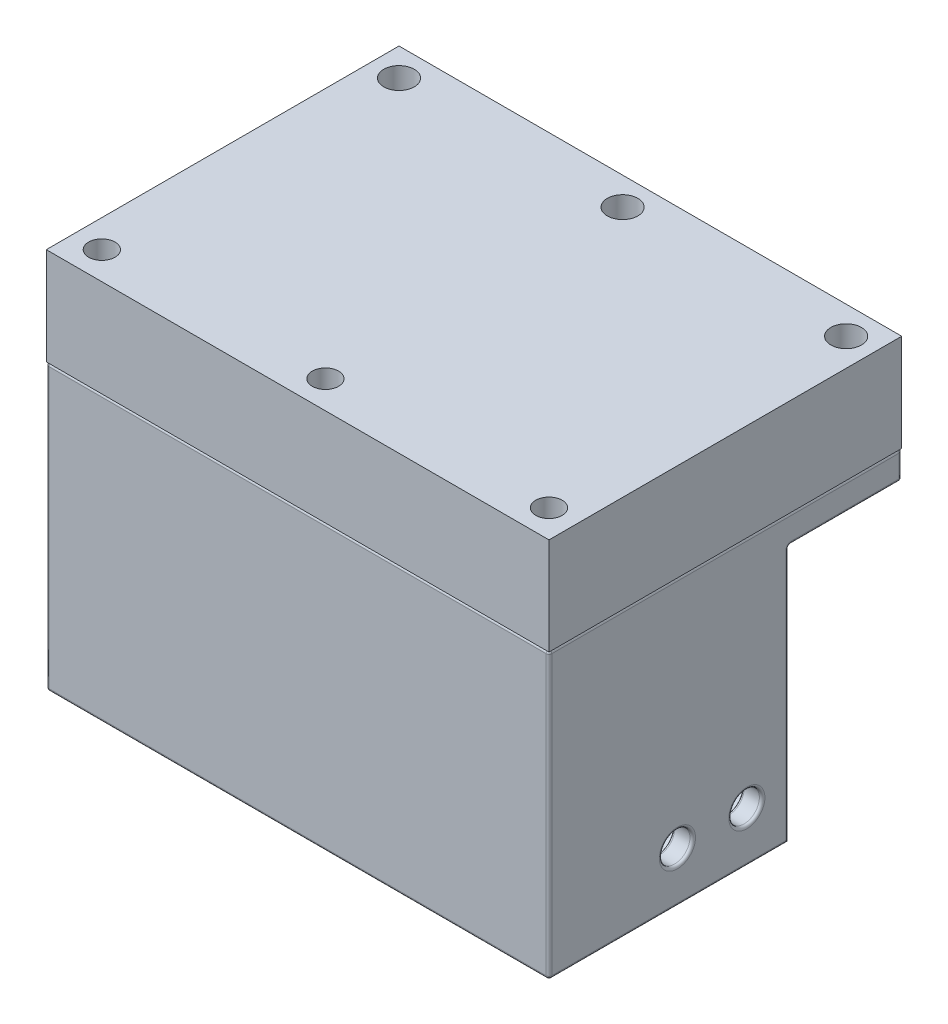
from build123d import *

# Parameters (mm, degrees)
SKETCH_1_W                = 26.2
SKETCH_1_H                = 15.4
SKETCH_1_R                = 1.5
SKETCH_1_W_2              = 25
SKETCH_1_H_2              = 2.55
EXTRUDE_1_DEPTH           = 1.6
SKETCH_1_3_W              = 25
SKETCH_1_3_H              = 2.55
EXTRUDE_2_DEPTH           = 2.65
SKETCH_2_W                = 0.628205128
SKETCH_2_H                = 3.5
EXTRUDE_3_DEPTH           = 1.7
SKETCH_3_W                = 36.2
SKETCH_3_H                = 25.4
SKETCH_3_W_2              = 26.2
SKETCH_3_H_2              = 15.4
SKETCH_3_R                = 1.5
SKETCH_3_W_3              = 25.4
SKETCH_3_H_3              = 2.95
SKETCH_3_R_2              = 1.45
EXTRUDE_4_DEPTH           = 2
SKETCH_4_W                = 36.2
SKETCH_4_H                = 25.4
SKETCH_4_R                = 1.1
SKETCH_4_R_2              = 0.95
SKETCH_4_W_2              = 28.2
SKETCH_4_H_2              = 17.4
EXTRUDE_5_DEPTH           = 5
SKETCH_5_W                = 36.2
SKETCH_5_H                = 25.4
SKETCH_5_R                = 0.95
SKETCH_5_R_2              = 1.1
EXTRUDE_6_DEPTH           = 2
SKETCH_6_W                = 36.2
SKETCH_6_H                = 17.25
SKETCH_6_R                = 1.45
EXTRUDE_8_DEPTH           = 18.68
CUT_EXTRUDE_START         = -25.68
CUT_EXTRUDE_1_OUTLINE_R   = 0.95
CUT_EXTRUDE_1_OUTLINE_R_2 = 1.1
CUT_EXTRUDE_1_DEPTH       = 20.68
SKETCH_11_R               = 1.1
CUT_EXTRUDE_3_DEPTH       = 44.582019228
SKETCH_12_W               = 30.2
SKETCH_12_H               = 7.68
CUT_EXTRUDE_4_DEPTH       = 13.25
CUT_EXTRUDE_START_2       = -3
CUT_EXTRUDE_5_DEPTH       = 1.5
CUT_EXTRUDE_START_3       = -33.2
CUT_EXTRUDE_6_DEPTH       = 1.5
CUT_EXTRUDE_7_DEPTH       = 0.2
FILLET_1_R                = 0.2


# Read off the part's stored shape, not the designer's step: 컷-돌출1
with BuildPart() as part:
    # 스케치1 → 보스-돌출1 (new body)
    # profile 1 of 2: a face of its own
    with BuildSketch(Plane(origin=(0, 0, 0), x_dir=(1, 0, 0), z_dir=(0, 1, 0))):
        Rectangle(SKETCH_1_W, SKETCH_1_H)
        with Locations(Location((-10.15, -5.1, 0), (0, 0, 270))):
            Circle(SKETCH_1_R, mode=Mode.SUBTRACT)
        with Locations(Location((10.15, -5.1, 0), (0, 0, 270))):
            Circle(SKETCH_1_R, mode=Mode.SUBTRACT)
        with Locations((0, 6.025)):
            Rectangle(SKETCH_1_W_2, SKETCH_1_H_2, mode=Mode.SUBTRACT)
    # profile 2 of 2: a face of its own
    with BuildSketch(Plane(origin=(0, 0, 0), x_dir=(1, 0, 0), z_dir=(0, 1, 0))):
        with Locations((0, 6.025)):
            Rectangle(SKETCH_1_W_2, SKETCH_1_H_2)
    extrude(amount=EXTRUDE_1_DEPTH)

    # 스케치1<3> → 보스-돌출2 (add)
    with BuildSketch(Plane(origin=(0, 0, 0), x_dir=(1, 0, 0), z_dir=(0, 1, 0))):
        with Locations((0, 6.025)):
            Rectangle(SKETCH_1_3_W, SKETCH_1_3_H)
    extrude(amount=-EXTRUDE_2_DEPTH)

    # 스케치2 → 보스-돌출3 (add)
    with BuildSketch(Plane(origin=(0, 1.6, 0), x_dir=(1, 0, 0), z_dir=(0, 1, 0))):
        Polygon((0.5, -1.5), (-0.5, -1.5), (-0.5, -5.5), (-1.2, -5.5), (0, -6.930104311), (1.2, -5.5), (0.5, -5.5), align=None)
        Polygon((5.5, -1.2), (6.930104311, 0), (5.5, 1.2), (5.5, 0.5), (1.5, 0.5), (1.5, -0.5), (5.5, -0.5), align=None)
        with Locations((-3.28532471, 3.544331345)):
            Rectangle(SKETCH_2_W, SKETCH_2_H)
        Polygon((-1.886586729, 5.294331345), (-1.23454346, 5.294331345), (-0.435965736, 2.853025255), (0.368220963, 5.294331345), (1.013954136, 5.294331345), (1.605700931, 1.794331345), (0.969783463, 1.794331345), (0.596085547, 4.004968364), (-0.131678877, 1.794331345), (-0.744459325, 1.794331345), (-1.468017018, 4.004968364), (-1.841013812, 1.794331345), (-2.477632402, 1.794331345), align=None)
        with BuildLine():
            Line((2.189034264, 5.294331345), (2.817239393, 5.294331345))
            Line((2.817239393, 5.294331345), (2.817239393, 3.017087755))
            add(Edge.make_bspline(
                [(2.817239393, 3.017087755), (2.817273551, 2.993478281), (2.817339529, 2.947876826), (2.82064238, 2.882453669), (2.823664717, 2.822316089), (2.82911787, 2.767529925), (2.837174047, 2.71807174), (2.844975055, 2.673623833), (2.855532948, 2.634981994), (2.871399773, 2.590997464), (2.895845342, 2.541578443), (2.935788046, 2.490072805), (2.981878508, 2.443066435), (3.037120582, 2.403940113), (3.099207788, 2.372290446), (3.167798984, 2.348841544), (3.242797481, 2.335807069), (3.294654828, 2.333817117), (3.321345963, 2.332792883)],
                knots=[0, 0, 0, 0, 1.155499968, 2.231836252, 3.205919964, 4.102923608, 4.924856345, 5.658536265, 6.31071849, 6.882491295, 7.94666036, 8.992281882, 10.060072772, 11.158554251, 12.289267114, 13.461410017, 14.693379945, 16, 16, 16, 16], degree=3))
            add(Edge.make_bspline(
                [(3.321345963, 2.332792883), (3.349702001, 2.333620333), (3.404991473, 2.33523372), (3.484516578, 2.351070858), (3.558197038, 2.376289005), (3.624472787, 2.412281729), (3.68327787, 2.455425316), (3.733055141, 2.504622525), (3.772339181, 2.55997148), (3.797943056, 2.611035105), (3.812318371, 2.658034726), (3.823093386, 2.700027104), (3.830992664, 2.749573953), (3.838159148, 2.805901493), (3.842465653, 2.869593167), (3.847135356, 2.940136761), (3.848846846, 3.018014951), (3.849138556, 3.072242996), (3.849290675, 3.100521249)],
                knots=[0, 0, 0, 0, 1.261321664, 2.459363699, 3.594844139, 4.716940403, 5.803436589, 6.833651888, 7.818396249, 8.814403945, 9.360733334, 10.004355033, 10.743453831, 11.592799886, 12.532235708, 13.585170094, 14.740740724, 16, 16, 16, 16], degree=3))
            Line((3.849290675, 3.100521249), (3.849290675, 5.294331345))
            Line((3.849290675, 5.294331345), (4.477495803, 5.294331345))
            Line((4.477495803, 5.294331345), (4.477495803, 3.20639064))
            add(Edge.make_bspline(
                [(4.477495803, 3.20639064), (4.477408565, 3.164089061), (4.477240816, 3.08274725), (4.474664688, 2.965853344), (4.469180577, 2.859089511), (4.464574557, 2.762424556), (4.455660331, 2.675988702), (4.446373798, 2.599412843), (4.434537313, 2.532968347), (4.416925335, 2.457329363), (4.386532275, 2.370233842), (4.337534678, 2.269947127), (4.275335399, 2.171760357), (4.201818961, 2.076753656), (4.118812177, 1.988495493), (4.028155486, 1.91101625), (3.931289197, 1.845477164), (3.827201127, 1.793480747), (3.71597986, 1.752927462), (3.596524945, 1.725677696), (3.46891784, 1.707267413), (3.380777201, 1.705498879), (3.335368399, 1.704587755)],
                knots=[0, 0, 0, 0, 1.170808336, 2.251350247, 3.235597562, 4.129743112, 4.929140599, 5.639994148, 6.264258765, 6.79612947, 7.788252245, 8.809469599, 9.879094798, 10.999557536, 12.129761673, 13.226370002, 14.293821979, 15.358369427, 16.438775801, 17.562147481, 18.744053101, 20, 20, 20, 20], degree=3))
            add(Edge.make_bspline(
                [(3.335368399, 1.704587755), (3.305197888, 1.705095937), (3.245672088, 1.706098571), (3.158128956, 1.714939179), (3.073501323, 1.727966912), (2.991948202, 1.746973032), (2.913186538, 1.771525389), (2.837237257, 1.801747631), (2.764382604, 1.837471182), (2.695030264, 1.878367463), (2.62926558, 1.92258975), (2.569160054, 1.971612016), (2.512645313, 2.021808881), (2.461354044, 2.075292841), (2.414901005, 2.131502406), (2.373381866, 2.190564964), (2.33685831, 2.252475271), (2.304411607, 2.318349254), (2.276640395, 2.391535053), (2.253228221, 2.474635914), (2.232774795, 2.568954362), (2.217575015, 2.67470289), (2.203794806, 2.791532964), (2.195072693, 2.919748944), (2.190509763, 3.059354507), (2.189538525, 3.156140151), (2.189034264, 3.20639064)],
                knots=[0, 0, 0, 0, 1.001158378, 1.975264943, 2.917723546, 3.841610987, 4.75185031, 5.653588123, 6.552117133, 7.442167995, 8.324307438, 9.179605724, 10.014504199, 10.831958861, 11.636465792, 12.43274043, 13.225645099, 14.020104002, 14.867201867, 15.819789774, 16.883317127, 18.068162734, 19.364263498, 20.787406516, 22.332041935, 24, 24, 24, 24], degree=3))
            Line((2.189034264, 3.20639064), (2.189034264, 5.294331345))
        make_face()
        Polygon((1.779131112, -4.434974289), (2.226887522, -4.434974289), (2.66913178, -5.114665128), (3.112224061, -4.434974289), (3.560404483, -4.434974289), (2.893009985, -5.458538659), (3.604501705, -6.551640956), (3.156745295, -6.551640956), (2.66913178, -5.801988178), (2.18024623, -6.551640956), (1.732065808, -6.551640956), (2.445253575, -5.458114647), align=None)
        Polygon((6.501577719, -0.872404796), (6.924317436, -0.872404796), (7.302111907, -1.614849374), (7.679906378, -0.872404796), (8.102646095, -0.872404796), (7.492069172, -2.072358055), (7.492069172, -2.989071463), (7.112154642, -2.989071463), (7.112154642, -2.072358055), align=None)
    extrude(amount=EXTRUDE_3_DEPTH)


with BuildPart() as body_2:
    # 스케치3 → 보스-돌출4 (new body)
    # profile 1 of 4: a face of its own
    with BuildSketch(Plane.XZ):
        Rectangle(SKETCH_3_W, SKETCH_3_H)
        Rectangle(SKETCH_3_W_2, SKETCH_3_H_2, mode=Mode.SUBTRACT)
    # profile 2 of 4: a face of its own
    with BuildSketch(Plane.XZ):
        Rectangle(SKETCH_3_W_2, SKETCH_3_H_2)
        with Locations(Location((-10.15, 5.1, 0), (0, 0, 90))):
            Circle(SKETCH_3_R, mode=Mode.SUBTRACT)
        with Locations(Location((10.15, 5.1, 0), (0, 0, 90))):
            Circle(SKETCH_3_R, mode=Mode.SUBTRACT)
        with Locations((0, -6.025)):
            Rectangle(SKETCH_3_W_3, SKETCH_3_H_3, mode=Mode.SUBTRACT)
    # profile 3 of 4: a face of its own
    with BuildSketch(Plane.XZ):
        with Locations(Location((-10.15, 5.1, 0), (0, 0, 90))):
            Circle(SKETCH_3_R)
        with Locations(Location((-10.15, 5.1, 0), (0, 0, 270))):
            Circle(SKETCH_3_R_2, mode=Mode.SUBTRACT)
    # profile 4 of 4: a face of its own
    with BuildSketch(Plane.XZ):
        with Locations(Location((10.15, 5.1, 0), (0, 0, 90))):
            Circle(SKETCH_3_R)
        with Locations(Location((10.15, 5.1, 0), (0, 0, 270))):
            Circle(SKETCH_3_R_2, mode=Mode.SUBTRACT)
    extrude(amount=EXTRUDE_4_DEPTH)

    # 스케치6 → 보스-돌출8 (add)
    with BuildSketch(Plane.XZ.offset(2)):
        with Locations((0, 4.075)):
            Rectangle(SKETCH_6_W, SKETCH_6_H)
        with Locations(Location((-10.15, 5.1, 0), (0, 0, 270))):
            Circle(SKETCH_6_R, mode=Mode.SUBTRACT)
        with Locations(Location((10.15, 5.1, 0), (0, 0, 270))):
            Circle(SKETCH_6_R, mode=Mode.SUBTRACT)
    extrude(amount=EXTRUDE_8_DEPTH)

    # 컷-돌출1 outline → 컷-돌출1 (cut)
    with BuildSketch(Plane(origin=(0, 5, 0), x_dir=(1, 0, 0), z_dir=(0, 1, 0)).offset(CUT_EXTRUDE_START)):
        with Locations((-16.1, -10.7)):
            Circle(CUT_EXTRUDE_1_OUTLINE_R)
        with Locations((-16.1, 10.7)):
            Circle(CUT_EXTRUDE_1_OUTLINE_R_2)
        with Locations((16.1, 10.7)):
            Circle(CUT_EXTRUDE_1_OUTLINE_R_2)
        with Locations((0, 10.7)):
            Circle(CUT_EXTRUDE_1_OUTLINE_R_2)
        with Locations((0, -10.7)):
            Circle(CUT_EXTRUDE_1_OUTLINE_R)
        with Locations((16.1, -10.7)):
            Circle(CUT_EXTRUDE_1_OUTLINE_R)
    extrude(amount=CUT_EXTRUDE_1_DEPTH, mode=Mode.SUBTRACT)

    # 스케치11 → 컷-돌출3 (cut, through all)
    with BuildSketch(Plane.ZY.offset(18.1)):
        with Locations((-1.55, -16.84)):
            Circle(SKETCH_11_R)
        with Locations((3.45, -16.84)):
            Circle(SKETCH_11_R)
    extrude(amount=-CUT_EXTRUDE_3_DEPTH, mode=Mode.SUBTRACT)

    # 스케치12 → 컷-돌출4 (cut)
    with BuildSketch(Plane(origin=(0, 0, -4.55), x_dir=(-1, 0, 0), z_dir=(0, 0, -1))):
        with Locations((0, -16.84)):
            Rectangle(SKETCH_12_W, SKETCH_12_H)
    extrude(amount=-CUT_EXTRUDE_4_DEPTH, mode=Mode.SUBTRACT)

    # 스케치13 → 컷-돌출5 (cut)
    with BuildSketch(Plane.ZY.offset(18.1).offset(CUT_EXTRUDE_START_2)):
        Polygon((-1.55, -14.472863896), (-3.6, -15.656431948), (-3.6, -18.023568052), (-1.55, -19.207136104), (0.5, -18.023568052), (0.5, -15.656431948), align=None)
        Polygon((3.45, -14.472863896), (1.4, -15.656431948), (1.4, -18.023568052), (3.45, -19.207136104), (5.5, -18.023568052), (5.5, -15.656431948), align=None)
    extrude(amount=CUT_EXTRUDE_5_DEPTH, mode=Mode.SUBTRACT)

    # 스케치13<2> → 컷-돌출6 (cut)
    with BuildSketch(Plane.ZY.offset(18.1).offset(CUT_EXTRUDE_START_3)):
        Polygon((-1.55, -14.472863896), (-3.6, -15.656431948), (-3.6, -18.023568052), (-1.55, -19.207136104), (0.5, -18.023568052), (0.5, -15.656431948), align=None)
        Polygon((3.45, -14.472863896), (1.4, -15.656431948), (1.4, -18.023568052), (3.45, -19.207136104), (5.5, -18.023568052), (5.5, -15.656431948), align=None)
    extrude(amount=-CUT_EXTRUDE_6_DEPTH, mode=Mode.SUBTRACT)

    # 스케치14 → 컷-돌출7 (cut)
    with BuildSketch(Plane.XZ.offset(20.68)):
        Polygon((15.1, 8.7), (15.1, -4.55), (18.1, -4.55), (18.1, 12.7), (-18.1, 12.7), (-18.1, -4.55), (-15.1, -4.55), (-15.1, 8.7), align=None)
    extrude(amount=-CUT_EXTRUDE_7_DEPTH, mode=Mode.SUBTRACT)

    # 필렛1
    fillet_1_edges = [body_2.edges().sort_by_distance(p)[0] for p in [
        (18.1, -16.84, -2.65),
        (-18.1, -16.84, -2.65),
        (-18.1, -16.84, 2.35),
        (18.1, -16.84, 2.35),
        (10.15, -13, 6.55),
        (-10.15, -13, 6.55),
        (15.1, -16.74, 8.7),
        (-15.1, -13, 2.075),
        (0, -13, 8.7),
        (15.1, -13, 2.075),
        (0, -13, -4.55),
        (15.1, -16.74, -4.55),
        (-16.6, -16.84, -2.65),
        (-15.1, -15.064647922, -0.525),
        (-15.1, -15.064647922, -2.575),
        (-15.1, -16.84, -3.6),
        (-15.1, -18.615352078, -2.575),
        (-15.1, -18.615352078, -0.525),
        (-15.1, -16.84, 0.5),
        (-16.6, -16.84, 2.35),
        (-15.1, -15.064647922, 4.475),
        (-15.1, -15.064647922, 2.425),
        (-15.1, -16.84, 1.4),
        (-15.1, -18.615352078, 2.425),
        (-15.1, -18.615352078, 4.475),
        (-15.1, -16.84, 5.5),
        (-10.15, 0, 6.55),
        (10.15, 0, 6.55),
        (-12.7, 0, -6.025),
        (0, 0, -7.5),
        (16.6, -16.84, -2.65),
        (15.1, -18.615352078, -0.525),
        (15.1, -18.615352078, -2.575),
        (15.1, -16.84, -3.6),
        (15.1, -15.064647922, -2.575),
        (15.1, -15.064647922, -0.525),
        (12.7, 0, -6.025),
        (15.1, -16.84, 0.5),
        (16.6, -16.84, 2.35),
        (15.1, -18.615352078, 4.475),
        (15.1, -18.615352078, 2.425),
        (15.1, -16.84, 1.4),
        (15.1, -15.064647922, 2.425),
        (15.1, -15.064647922, 4.475),
        (15.1, -16.84, 5.5),
        (0, 0, -4.55),
        (0, 0, -12.7),
        (-18.1, 0, 0),
        (-15.1, -16.74, 8.7),
        (-18.1, -10.24, 12.7),
        (18.1, -10.24, 12.7),
        (-15.1, -16.74, -4.55),
        (-18.1, -11.24, -4.55),
        (18.1, -11.24, -4.55),
        (15.15, -20.48, 10.7),
        (-0.95, -20.48, 10.7),
        (-17.05, -20.48, 10.7),
        (0, -20.48, 8.7),
        (0, 0, 12.7),
        (-15.1, -20.48, 2.075),
        (-18.1, -20.48, 4.075),
        (0, -20.48, 12.7),
        (18.1, -20.48, 4.075),
        (15.1, -20.48, 2.075),
        (18.1, 0, 0),
        (-12.7, -1, -4.55),
        (12.7, -1, -4.55),
        (18.1, -1, -12.7),
        (-18.1, -1, -12.7),
        (0, -2, -12.7),
        (18.1, -2, -8.625),
        (-18.1, -2, -8.625),
        (15.4, -2, -4.55),
        (-15.4, -2, -4.55),
        (12.7, -2, -6.025),
        (0, -2, -7.5),
        (-17.05, 0, 10.7),
        (-12.7, -2, -6.025),
        (-0.95, 0, 10.7),
        (15.15, 0, 10.7),
        (15, -2, -10.7),
        (15, 0, -10.7),
        (-1.1, -2, -10.7),
        (-1.1, 0, -10.7),
        (-17.2, -2, -10.7),
        (-17.2, 0, -10.7),
    ]]
    fillet(fillet_1_edges, radius=FILLET_1_R)


with BuildPart() as body_3:
    # 스케치4 → 보스-돌출5 (new body)
    with BuildSketch(Plane(origin=(0, 0, 0), x_dir=(1, 0, 0), z_dir=(0, 1, 0))):
        Rectangle(SKETCH_4_W, SKETCH_4_H)
        with Locations(Location((-16.1, 10.7, 0), (0, 0, 270))):
            Circle(SKETCH_4_R, mode=Mode.SUBTRACT)
        with Locations(Location((16.1, 10.7, 0), (0, 0, 270))):
            Circle(SKETCH_4_R, mode=Mode.SUBTRACT)
        with Locations(Location((-16.1, -10.7, 0), (0, 0, 270))):
            Circle(SKETCH_4_R_2, mode=Mode.SUBTRACT)
        with Locations(Location((16.1, -10.7, 0), (0, 0, 270))):
            Circle(SKETCH_4_R_2, mode=Mode.SUBTRACT)
        with Locations(Location((0, -10.7, 0), (0, 0, 270))):
            Circle(SKETCH_4_R_2, mode=Mode.SUBTRACT)
        with Locations(Location((0, 10.7, 0), (0, 0, 270))):
            Circle(SKETCH_4_R, mode=Mode.SUBTRACT)
        Rectangle(SKETCH_4_W_2, SKETCH_4_H_2, mode=Mode.SUBTRACT)
    extrude(amount=EXTRUDE_5_DEPTH)

    # 스케치5 → 보스-돌출6 (add)
    with BuildSketch(Plane(origin=(0, 5, 0), x_dir=(1, 0, 0), z_dir=(0, 1, 0))):
        Rectangle(SKETCH_5_W, SKETCH_5_H)
        with Locations(Location((-16.1, -10.7, 0), (0, 0, 270))):
            Circle(SKETCH_5_R, mode=Mode.SUBTRACT)
        with Locations(Location((0, -10.7, 0), (0, 0, 270))):
            Circle(SKETCH_5_R, mode=Mode.SUBTRACT)
        with Locations(Location((16.1, -10.7, 0), (0, 0, 270))):
            Circle(SKETCH_5_R, mode=Mode.SUBTRACT)
        with Locations(Location((16.1, 10.7, 0), (0, 0, 270))):
            Circle(SKETCH_5_R_2, mode=Mode.SUBTRACT)
        with Locations(Location((0, 10.7, 0), (0, 0, 270))):
            Circle(SKETCH_5_R_2, mode=Mode.SUBTRACT)
        with Locations(Location((-16.1, 10.7, 0), (0, 0, 270))):
            Circle(SKETCH_5_R_2, mode=Mode.SUBTRACT)
    extrude(amount=EXTRUDE_6_DEPTH)


solid = Compound([part.part, body_2.part, body_3.part])
